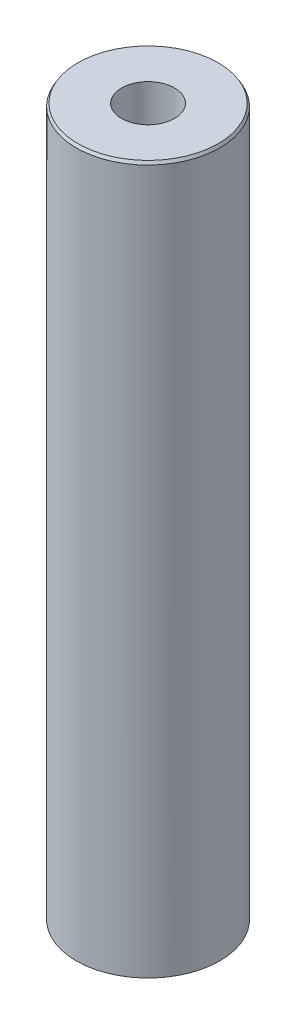
from build123d import *
from OCP.BRepFilletAPI import BRepFilletAPI_MakeChamfer

# Parameters (mm, degrees)
SKETCH1_R           = 22.5
BOSS_EXTRUDE1_DEPTH = 222.13833736
SKETCH2_R           = 8.300214599
CUT_EXTRUDE1_DEPTH  = 225.405750651
CHAMFER1_SIZE       = 0.893257763
CHAMFER1_SIZE2      = 0.51572261


with BuildPart() as part:
    # Sketch1 → Boss-Extrude1 (new body)
    with BuildSketch(Plane(origin=(0, 0, 0), x_dir=(1, 0, 0), z_dir=(0, 1, 0))):
        Circle(SKETCH1_R)
    extrude(amount=BOSS_EXTRUDE1_DEPTH)

    # Sketch2 → Cut-Extrude1 (cut, through all)
    with BuildSketch(Plane(origin=(0, 0, 0), x_dir=(1, 0, 0), z_dir=(0, 1, 0))):
        Circle(SKETCH2_R)
    extrude(amount=CUT_EXTRUDE1_DEPTH, mode=Mode.SUBTRACT)

    # Chamfer1: one chamfer whose edges measure the first distance from different faces: ONE call of the kernel's chamfer builder (chamfer() names one face for all edges)
    chamfer1_edges_1 = [part.edges().sort_by_distance(p)[0] for p in [
        (-22.5, 222.13833736, 0),
    ]]
    chamfer1_side_1 = [part.faces().sort_by_distance(p)[0] for p in [
        (-22.5, 111.06916868, 0),
    ]]
    chamfer1_edges_2 = [part.edges().sort_by_distance(p)[0] for p in [
        (-22.5, 0, 0),
    ]]
    chamfer1_side_2 = [part.faces().sort_by_distance(p)[0] for p in [
        (-21.863603897, 0, 0),
    ]]
    chamfer1 = BRepFilletAPI_MakeChamfer(part.part.solid().wrapped)
    for e in chamfer1_edges_1:
        chamfer1.Add(CHAMFER1_SIZE, CHAMFER1_SIZE2, e.wrapped, chamfer1_side_1[0].wrapped)  # the first distance lies on this face
    for e in chamfer1_edges_2:
        chamfer1.Add(CHAMFER1_SIZE, CHAMFER1_SIZE2, e.wrapped, chamfer1_side_2[0].wrapped)  # the first distance lies on this face
    add(Compound.cast(chamfer1.Shape()), mode=Mode.REPLACE)


solid = part.part
